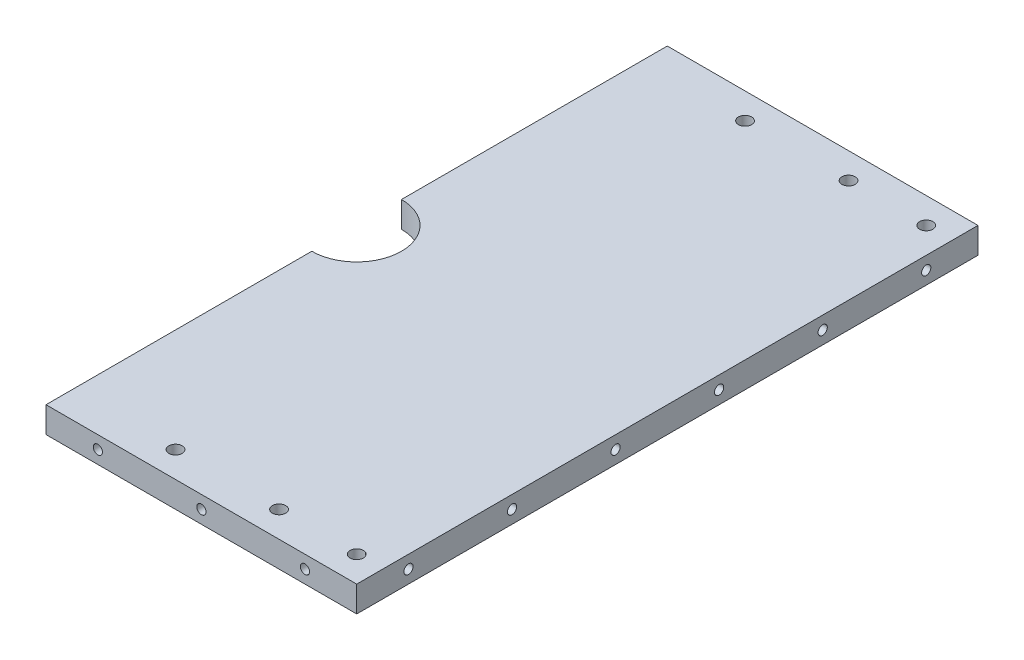
from build123d import *

# Parameters (mm, degrees)
SKETCH1_R           = 1.63195
BOSS_EXTRUDE1_DEPTH = 6.35
LPATTERN1_COUNT     = 6
LPATTERN1_PITCH     = 25.4
LPATTERN2_COUNT     = 3
LPATTERN2_PITCH     = 25.4


with BuildPart() as part:
    # Sketch1 → Boss-Extrude1 (new body)
    with BuildSketch(Plane(origin=(0, 0, 0), x_dir=(1, 0, 0), z_dir=(0, 1, 0))):
        with BuildLine():
            Line((0, -11), (0, -76.2))
            Line((0, -76.2), (76.22, -76.2))
            Line((76.22, -76.2), (76.22, 76.2))
            Line((76.22, 76.2), (0, 76.2))
            Line((0, 76.2), (0, 11))
            ThreePointArc((0, 11), (11, 0), (0, -11))
        make_face()
        with Locations((69.87, 69.85)):
            Circle(SKETCH1_R, mode=Mode.SUBTRACT)
        with Locations((69.87, -69.85)):
            Circle(SKETCH1_R, mode=Mode.SUBTRACT)
        with Locations((50.82, 69.85)):
            Circle(SKETCH1_R, mode=Mode.SUBTRACT)
        with Locations((25.42, 69.85)):
            Circle(SKETCH1_R, mode=Mode.SUBTRACT)
        with Locations((50.82, -69.85)):
            Circle(SKETCH1_R, mode=Mode.SUBTRACT)
        with Locations((25.42, -69.85)):
            Circle(SKETCH1_R, mode=Mode.SUBTRACT)
    extrude(amount=BOSS_EXTRUDE1_DEPTH)

    # Sketch2 → #4-40 Tapped Hole1 (revolve, cut)
    with BuildSketch(Plane(origin=(76.22, 3.175, 63.5), x_dir=(0, 0, -1), z_dir=(0, 1, 0))):
        Polygon((0, 0), (0, 8.279152758), (1.1303, 7.6), (1.1303, 0), align=None)
    f_4_40_tapped_hole1 = revolve(axis=Axis((82.57, 3.175, 63.5), (-1, 0, 0)), mode=Mode.SUBTRACT)

    # LPattern1: #4-40 Tapped Hole1 ×6
    with Locations(*[(0, 0, -i * LPATTERN1_PITCH) for i in range(1, LPATTERN1_COUNT)]):
        add(f_4_40_tapped_hole1, mode=Mode.SUBTRACT)

    # Sketch3 → #4-40 Tapped Hole2 (revolve, cut)
    with BuildSketch(Plane(origin=(63.52, 3.175, 76.2), x_dir=(0, -1, 0), z_dir=(1, 0, 0))):
        Polygon((0, 0), (0, 8.279152758), (1.1303, 7.6), (1.1303, 0), align=None)
    f_4_40_tapped_hole2 = revolve(axis=Axis((63.52, 3.175, 82.55), (0, 0, -1)), mode=Mode.SUBTRACT)

    # LPattern2: #4-40 Tapped Hole2 ×3
    with Locations(*[(-i * LPATTERN2_PITCH, 0, 0) for i in range(1, LPATTERN2_COUNT)]):
        add(f_4_40_tapped_hole2, mode=Mode.SUBTRACT)

    # Mirror1 copy 1 sketch → Mirror1 copy 1 (revolve, cut)
    with BuildSketch(Plane(origin=(38.12, 3.175, -76.2), x_dir=(0, -1, 0), z_dir=(1, 0, 0))):
        Polygon((0, 0), (0, -8.279152758), (1.1303, -7.6), (1.1303, 0), align=None)
    revolve(axis=Axis((38.12, 3.175, -82.55), (0, 0, -1)), mode=Mode.SUBTRACT)

    # Mirror1 copy 2 sketch → Mirror1 copy 2 (revolve, cut)
    with BuildSketch(Plane(origin=(12.72, 3.175, -76.2), x_dir=(0, -1, 0), z_dir=(1, 0, 0))):
        Polygon((0, 0), (0, -8.279152758), (1.1303, -7.6), (1.1303, 0), align=None)
    revolve(axis=Axis((12.72, 3.175, -82.55), (0, 0, -1)), mode=Mode.SUBTRACT)

    # Mirror1 copy 3 sketch → Mirror1 copy 3 (revolve, cut)
    with BuildSketch(Plane(origin=(63.52, 3.175, -76.2), x_dir=(0, -1, 0), z_dir=(1, 0, 0))):
        Polygon((0, 0), (0, -8.279152758), (1.1303, -7.6), (1.1303, 0), align=None)
    revolve(axis=Axis((63.52, 3.175, -82.55), (0, 0, -1)), mode=Mode.SUBTRACT)


solid = part.part
